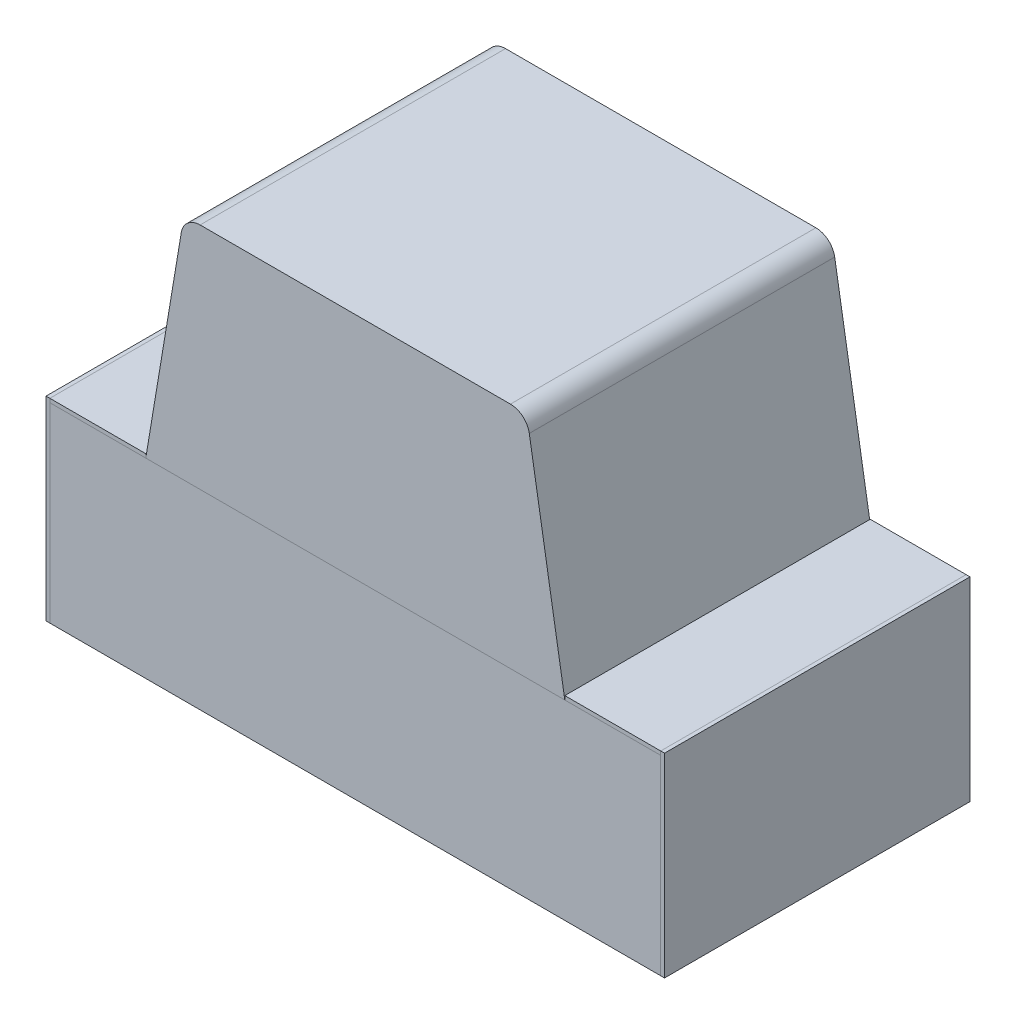
from build123d import *

# Parameters (mm, degrees)
SZKIC2_W                      = 1.6
SZKIC2_H                      = 0.8
DODANIE_WYCI_GNI_CIE1_DEPTH   = 0.5
SZKIC6_W                      = 1.097570152
SZKIC6_H                      = 0.8
DODANIE_WYCI_GNI_CIE4_DEPTH   = 0.6
SZKIC7_W                      = 0.263125241
SZKIC7_H                      = 0.267740406
DODANIE_WYCI_GNI_CIE5_DEPTH   = 0.12
SFAZOWANIE3_SIZE              = 0.6
SFAZOWANIE3_SIZE_2            = 0.1
SFAZOWANIE4_SIZE              = 0.1
SFAZOWANIE4_SIZE_2            = 0.6
ZAOKR_GLENIE3_R               = 0.05
ZAOKR_GLENIE4_R               = 0.05
SZKIC8_W                      = 0.251214924
SZKIC8_H                      = 0.8
DODANIE_WYCI_GNI_CIE6_DEPTH   = 0.01
DODANIE_WYCI_GNI_CIE6_2_DEPTH = 0.01
SZKIC9_W                      = 0.8
SZKIC9_H                      = 0.51
DODANIE_WYCI_GNI_CIE7_DEPTH   = 0.01
SZKIC10_W                     = 0.8
SZKIC10_H                     = 0.51
DODANIE_WYCI_GNI_CIE8_DEPTH   = 0.01
ZAOKR_GLENIE5_R               = 0.03


with BuildPart() as part:
    # Szkic2 → Dodanie-wyciągnięcie1 (new body)
    with BuildSketch(Plane(origin=(0, 0, 0), x_dir=(1, 0, 0), z_dir=(0, 1, 0))):
        Rectangle(SZKIC2_W, SZKIC2_H)
    extrude(amount=DODANIE_WYCI_GNI_CIE1_DEPTH)


with BuildPart() as body_2:
    # Szkic6 → Dodanie-wyciągnięcie4 (new body)
    with BuildSketch(Plane(origin=(0, 0.5, 0), x_dir=(1, 0, 0), z_dir=(0, 1, 0))):
        Rectangle(SZKIC6_W, SZKIC6_H)
    extrude(amount=DODANIE_WYCI_GNI_CIE4_DEPTH)

    # Sfazowanie3
    # the kernel refuses this chamfer: 0.6, 0.1 mm, written as the material it takes off along each edge
    with BuildSketch(Plane(origin=(-0.548785076, 1.1, 1.959214836), x_dir=(-0.0063262220237778315, -0.9999799892572381, 0), z_dir=(0, 0, -1))) as sfazowanie3_piece_1:
        Polygon((SFAZOWANIE3_SIZE * 0.999979989257, -SFAZOWANIE3_SIZE * 0.00632622202378), (-SFAZOWANIE3_SIZE_2 * 0.00632622202378, -SFAZOWANIE3_SIZE_2 * 0.999979989257), (0, 0), align=None)
    extrude(amount=3.918429673, mode=Mode.SUBTRACT)

    # Sfazowanie4
    # the kernel refuses this chamfer: 0.6, 0.1 mm, written as the material it takes off along each edge
    with BuildSketch(Plane(origin=(0.548785076, 1.1, -1.959214836), x_dir=(-0.9750324932942596, 0.2220622368174737, 0), z_dir=(0, 0, 1))) as sfazowanie4_piece_1:
        Polygon((SFAZOWANIE4_SIZE * 0.975032493294, SFAZOWANIE4_SIZE * 0.222062236817), (-SFAZOWANIE4_SIZE_2 * 0.222062236817, SFAZOWANIE4_SIZE_2 * 0.975032493294), (0, 0), align=None)
    extrude(amount=3.918429673, mode=Mode.SUBTRACT)

    # Zaokrąglenie3
    zaokr_glenie3_edges = [body_2.edges().sort_by_distance(p)[0] for p in [
        (0.448785076, 1.1, 0),
    ]]
    fillet(zaokr_glenie3_edges, radius=ZAOKR_GLENIE3_R)

    # Zaokrąglenie4
    zaokr_glenie4_edges = [body_2.edges().sort_by_distance(p)[0] for p in [
        (-0.448785076, 1.1, 0),
    ]]
    fillet(zaokr_glenie4_edges, radius=ZAOKR_GLENIE4_R)


with BuildPart() as body_3:
    # Szkic7 → Dodanie-wyciągnięcie5 (new body)
    with BuildSketch(Plane(origin=(0, 0.5, 0), x_dir=(1, 0, 0), z_dir=(0, 1, 0))):
        with Locations((0.245631468, 0)):
            Rectangle(SZKIC7_W, SZKIC7_H)
    extrude(amount=DODANIE_WYCI_GNI_CIE5_DEPTH)

    # Zaokrąglenie5
    zaokr_glenie5_edges = [body_3.edges().sort_by_distance(p)[0] for p in [
        (0.114068847, 0.62, 0),
        (0.245631467, 0.62, 0.133870203),
        (0.377194088, 0.62, 0),
        (0.245631467, 0.62, -0.133870203),
    ]]
    fillet(zaokr_glenie5_edges, radius=ZAOKR_GLENIE5_R)


with BuildPart() as body_4:
    # Szkic8 → Dodanie-wyciągnięcie6 (new body)
    with BuildSketch(Plane(origin=(0, 0.5, 0), x_dir=(1, 0, 0), z_dir=(0, 1, 0))):
        with Locations((-0.674392538, 0)):
            Rectangle(SZKIC8_W, SZKIC8_H)
    extrude(amount=DODANIE_WYCI_GNI_CIE6_DEPTH)


with BuildPart() as body_5:
    # Szkic8 → Dodanie-wyci_gni_cie6 2 (new body)
    with BuildSketch(Plane(origin=(0, 0.5, 0), x_dir=(1, 0, 0), z_dir=(0, 1, 0))):
        with Locations((0.674392538, 0)):
            Rectangle(SZKIC8_W, SZKIC8_H)
    extrude(amount=DODANIE_WYCI_GNI_CIE6_2_DEPTH)


with BuildPart() as body_6:
    # Szkic9 → Dodanie-wyciągnięcie7 (new body)
    with BuildSketch(Plane.ZY.offset(0.8)):
        with Locations((0, 0.255)):
            Rectangle(SZKIC9_W, SZKIC9_H)
    extrude(amount=DODANIE_WYCI_GNI_CIE7_DEPTH)


with BuildPart() as body_7:
    # Szkic10 → Dodanie-wyciągnięcie8 (new body)
    with BuildSketch(Plane(origin=(0.8, 0, 0), x_dir=(0, 0, -1), z_dir=(1, 0, 0))):
        with Locations((0, 0.255)):
            Rectangle(SZKIC10_W, SZKIC10_H)
    extrude(amount=DODANIE_WYCI_GNI_CIE8_DEPTH)


solid = Compound([part.part, body_2.part, body_3.part, body_4.part, body_5.part, body_6.part, body_7.part])
